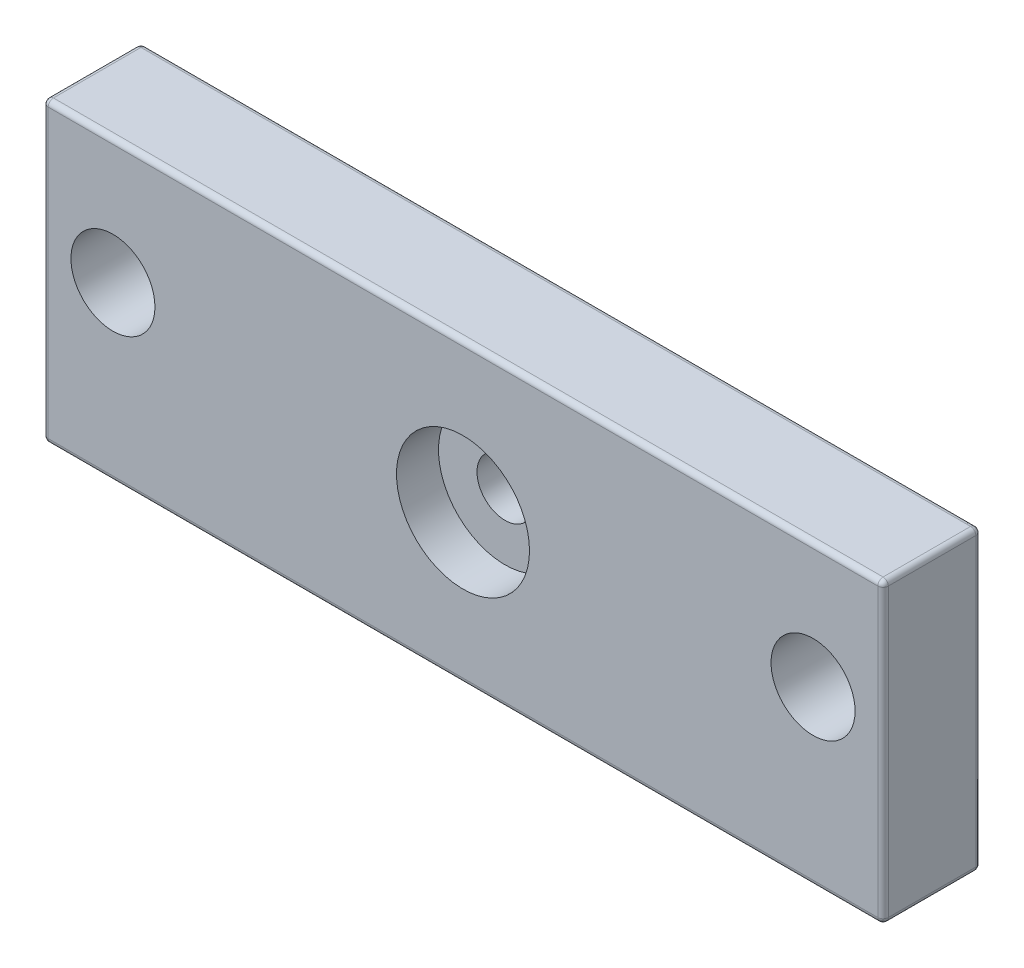
from build123d import *

# Parameters (mm, degrees)
SKETCH1_W           = 120
SKETCH1_H           = 42.5
BOSS_EXTRUDE1_DEPTH = 7
SKETCH2_R           = 9.5
CUT_EXTRUDE1_DEPTH  = 6
SKETCH3_R           = 4
CUT_EXTRUDE2_DEPTH  = 65.152649984
SKETCH5_R           = 6
CUT_EXTRUDE4_DEPTH  = 66.173326599
SKETCH6_R           = 2.1
SKETCH6_R_2         = 1.25
CUT_EXTRUDE5_DEPTH  = 10
FILLET1_R           = 0.75


with BuildPart() as part:
    # Sketch1 → Boss-Extrude1 (new, symmetric)
    with BuildSketch(Plane.XY):
        Rectangle(SKETCH1_W, SKETCH1_H)
    extrude(amount=BOSS_EXTRUDE1_DEPTH, both=True)

    # Sketch2 → Cut-Extrude1 (cut)
    with BuildSketch(Plane.XY.offset(7)):
        Circle(SKETCH2_R)
    extrude(amount=-CUT_EXTRUDE1_DEPTH, mode=Mode.SUBTRACT)

    # Sketch3 → Cut-Extrude2 (cut, through all)
    with BuildSketch(Plane.XY.offset(1)):
        Circle(SKETCH3_R)
    extrude(amount=-CUT_EXTRUDE2_DEPTH, mode=Mode.SUBTRACT)

    # Sketch5 → Cut-Extrude4 (cut, through all)
    with BuildSketch(Plane.XY.offset(7)):
        with Locations((-50, 3.4)):
            Circle(SKETCH5_R)
        with Locations((50, 3.4)):
            Circle(SKETCH5_R)
    extrude(amount=-CUT_EXTRUDE4_DEPTH, mode=Mode.SUBTRACT)

    # Sketch6 → Cut-Extrude5 (cut)
    with BuildSketch(Plane.XZ.offset(21.25)):
        with Locations((-50, 0)):
            Circle(SKETCH6_R)
        with Locations((-25, 0)):
            Circle(SKETCH6_R)
        with Locations((25, 0)):
            Circle(SKETCH6_R)
        with Locations((50, 0)):
            Circle(SKETCH6_R)
        with Locations((-37.5, 0)):
            Circle(SKETCH6_R_2)
        with Locations((37.5, 0)):
            Circle(SKETCH6_R_2)
    extrude(amount=-CUT_EXTRUDE5_DEPTH, mode=Mode.SUBTRACT)

    # Fillet1
    fillet1_edges = [part.edges().sort_by_distance(p)[0] for p in [
        (60, 21.25, 0),
        (60, 0, -7),
        (0, 21.25, -7),
        (60, 0, 7),
        (60, -21.25, 0),
        (0, -21.25, -7),
        (0, 21.25, 7),
        (-60, 21.25, 0),
        (-60, 0, -7),
        (0, -21.25, 7),
        (-60, -21.25, 0),
        (-60, 0, 7),
    ]]
    fillet(fillet1_edges, radius=FILLET1_R)


solid = part.part
